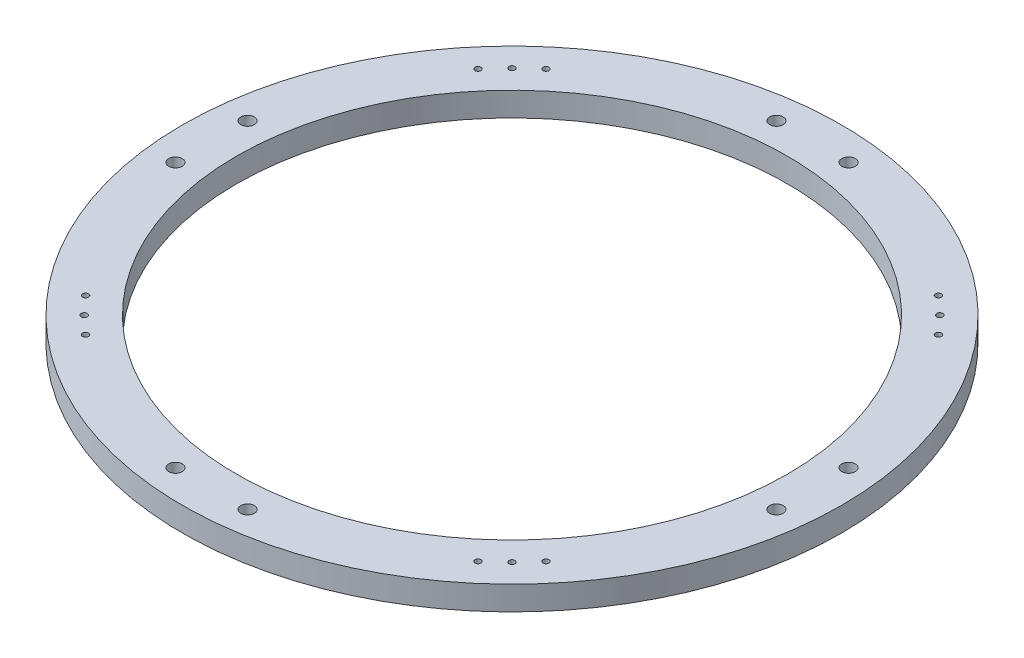
from build123d import *

# Parameters (mm, degrees)
SKETCH1_W                    = 28.575
SKETCH1_H                    = 12.7
F_1_8_0_125_DIAMETER_HOLE1_D = 3.175
SKETCH7_R                    = 3.571875
CUT_EXTRUDE1_DEPTH           = 247.543645639
CIRPATTERN1_COUNT            = 4


with BuildPart() as part:
    # Sketch1 → Revolve1 (revolve)
    with BuildSketch(Plane.XY):
        with Locations((159.813733777, 203.050503093)):
            Rectangle(SKETCH1_W, SKETCH1_H)
    revolve(axis=Axis((1e-09, -200000, 0), (0, 1, 0)))

    # 1/8 (0.125) Diameter Hole1 (through all)
    with Locations(Plane(origin=(0, 209.400503093, 0), x_dir=(1, 0, 0), z_dir=(0, 1, 0))):
        with Locations((-113.00537488, 113.00537488), (-103.667734326, 121.628246568), (-121.628246568, 103.667734326)):
            f_1_8_0_125_diameter_hole1 = Hole(F_1_8_0_125_DIAMETER_HOLE1_D / 2)

    # Sketch7 → Cut-Extrude1 (cut, through all)
    with BuildSketch(Plane(origin=(0, 209.400503093, 0), x_dir=(1, 0, 0), z_dir=(0, 1, 0))):
        with Locations((158.75, -19.05)):
            Circle(SKETCH7_R)
        with Locations((158.75, 19.05)):
            Circle(SKETCH7_R)
    cut_extrude1 = extrude(amount=-CUT_EXTRUDE1_DEPTH, mode=Mode.SUBTRACT)

    # CirPattern1: 1/8 (0.125) Diameter Hole1, Cut-Extrude1 ×4 about axis
    cirpattern1_axis = Axis((1e-09, -200000, 0), (0, -1, 0))
    add([f_1_8_0_125_diameter_hole1.rotate(cirpattern1_axis, i * 360 / CIRPATTERN1_COUNT) for i in range(1, CIRPATTERN1_COUNT)], mode=Mode.SUBTRACT)
    add([cut_extrude1.rotate(cirpattern1_axis, i * 360 / CIRPATTERN1_COUNT) for i in range(1, CIRPATTERN1_COUNT)], mode=Mode.SUBTRACT)


solid = part.part
